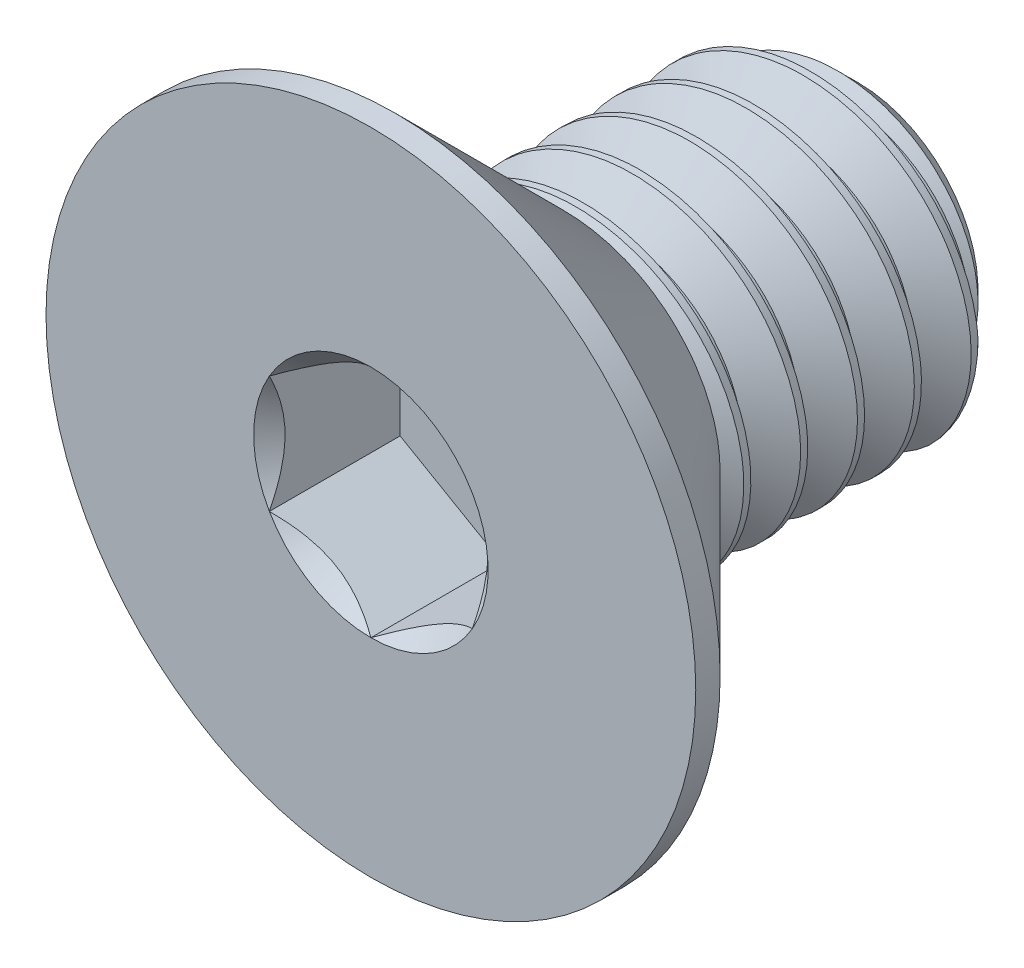
from build123d import *
from build123d.topology import SkipClean

# Parameters (mm, degrees)
SKETCH1_W          = 6
SKETCH1_H          = 2
CHAMFER1_SIZE      = 0.525
CUT_SWEEP1_PITCH   = 0.7
CUT_EXTRUDE2_DEPTH = 1.61


with BuildPart() as part:
    # Sketch1 → Revolve1 (revolve)
    with BuildSketch(Plane(origin=(0, 0, 0), x_dir=(0, 0, -1), z_dir=(1, 0, 0))):
        with Locations((3, 1)):
            Rectangle(SKETCH1_W, SKETCH1_H)
    revolve(axis=Axis((0, 0, -6), (0, 0, 1)))

    # Chamfer1
    chamfer1_edges = [part.edges().sort_by_distance(p)[0] for p in [
        (0, -2, -6),
    ]]
    chamfer(chamfer1_edges, length=CHAMFER1_SIZE)

    # Cut-Sweep1: arcs per turn and ends read off the stored shape
    # Cut-Sweep1: the profile of Sketch2 profile screwed along a right-hand helix through 9.666667 turns, 6 arcs to a turn; built about Z, then put on its axis
    cut_sweep1_z = Axis((0, 0, 0), (0, 0, 1))
    cut_sweep1_corners = [(2.0003, 0, 0.000173205), (2.0003, 0, -0.612673205), (1.545336663, 0, -0.35), (1.545336663, 0, -0.2625)]
    with BuildLine(mode=Mode.PRIVATE) as cut_sweep1_profile:
        Line(cut_sweep1_corners[0], cut_sweep1_corners[1])
        Line(cut_sweep1_corners[1], cut_sweep1_corners[2])
        Line(cut_sweep1_corners[2], cut_sweep1_corners[3])
        Line(cut_sweep1_corners[3], cut_sweep1_corners[0])
    cut_sweep1_cap = Face(cut_sweep1_profile.wire())
    cut_sweep1_turn_angles = [0, 30, 60, 90, 120, 150, 180, 210, 240, 270, 300, 330, 360]
    cut_sweep1_turn_weights = [1, 0.8660254037844387, 1, 0.8660254037844387, 1, 0.8660254037844387, 1, 0.8660254037844387, 1, 0.8660254037844387, 1, 0.8660254037844387, 1]
    cut_sweep1_turn_rails = [Edge.make_bspline([Vector(p[0], p[1], 0).rotate(cut_sweep1_z, cut_sweep1_turn_angles[k]) / cut_sweep1_turn_weights[k] + Vector(0, 0, p[2] + CUT_SWEEP1_PITCH * cut_sweep1_turn_angles[k] / 360) for k in range(13)], [0, 0, 0, 1, 1, 2, 2, 3, 3, 4, 4, 5, 5, 6, 6, 6], 2, cut_sweep1_turn_weights) for p in cut_sweep1_corners]
    cut_sweep1_turn_sides = [Face.make_surface_from_curves(cut_sweep1_turn_rails[p[0]], cut_sweep1_turn_rails[p[1]]) for p in [(0, 1), (1, 2), (2, 3), (3, 0)]]
    cut_sweep1_last_angles = [3240, 3270, 3300, 3330, 3360, 3390, 3420, 3450, 3480]
    cut_sweep1_last_weights = [1, 0.8660254037844387, 1, 0.8660254037844387, 1, 0.8660254037844387, 1, 0.8660254037844387, 1]
    cut_sweep1_last_rails = [Edge.make_bspline([Vector(p[0], p[1], 0).rotate(cut_sweep1_z, cut_sweep1_last_angles[k]) / cut_sweep1_last_weights[k] + Vector(0, 0, p[2] + CUT_SWEEP1_PITCH * cut_sweep1_last_angles[k] / 360) for k in range(9)], [0, 0, 0, 1, 1, 2, 2, 3, 3, 4, 4, 4], 2, cut_sweep1_last_weights) for p in cut_sweep1_corners]
    cut_sweep1_last_sides = [Face.make_surface_from_curves(cut_sweep1_last_rails[p[0]], cut_sweep1_last_rails[p[1]]) for p in [(0, 1), (1, 2), (2, 3), (3, 0)]]
    cut_sweep1 = Plane(origin=(0, 0, -6), x_dir=(0, 1, 0), z_dir=(0, 0, 1)) * Solid(Shell([*[p.moved(Location((0, 0, CUT_SWEEP1_PITCH * i))) for i in range(9) for p in cut_sweep1_turn_sides], *cut_sweep1_last_sides, cut_sweep1_cap, cut_sweep1_cap.rotate(cut_sweep1_z, 3480).moved(Location((0, 0, CUT_SWEEP1_PITCH * 3480 / 360)))]))
    add(cut_sweep1, mode=Mode.SUBTRACT)

    # Sketch7 → Revolve2 (revolve)
    with BuildSketch(Plane(origin=(0, 0, 0), x_dir=(0, 0, -1), z_dir=(1, 0, 0)), mode=Mode.PRIVATE) as revolve2_sk:
        Polygon((0, 4), (0.3, 4), (2.3, 2), (2.3, 0), (0, 0), align=None)
    revolve(revolve2_sk.sketch.rotate(Axis((0, 0, 0), (0, 0, -1)), 189.336081704), axis=Axis((0, 0, 0), (0, 0, -1)))

    # Boss-Extrude1 cone 1 section (through the dimple's axis) → Boss-Extrude1 (revolve)
    with SkipClean():  # the faces are left unmerged after this step: merging them gives an invalid solid
        with BuildSketch(Plane(origin=(0, 0, -2.3), x_dir=(0, -1, 0), z_dir=(1, 0, 0))):
            Polygon((0, 0), (2, 0), (0, 2), align=None)
        revolve(axis=Axis((0, 0, -2.3), (0, 0, -1)))

    # Sketch5 → Cut-Extrude2 (cut)
    with SkipClean():  # the faces are left unmerged after this step: merging them gives an invalid solid
        with BuildSketch(Plane.XY):
            Polygon((1.25, -0.721687836), (1.25, 0.721687836), (0, 1.443375673), (-1.25, 0.721687836), (-1.25, -0.721687836), (0, -1.443375673), align=None)
        extrude(amount=-CUT_EXTRUDE2_DEPTH, mode=Mode.SUBTRACT)

    # Cut-Extrude3 cone 1 section (through the dimple's axis) → Cut-Extrude3 (revolve, cut)
    with SkipClean():  # the faces are left unmerged after this step: merging them gives an invalid solid
        with BuildSketch(Plane(origin=(0, 0, 0), x_dir=(0, -1, 0), z_dir=(1, 0, 0))):
            Polygon((0, 0), (1.443375673, 0), (0, 1.443375673), align=None)
        revolve(axis=Axis((0, 0, 0), (0, 0, -1)), mode=Mode.SUBTRACT)


solid = part.part
